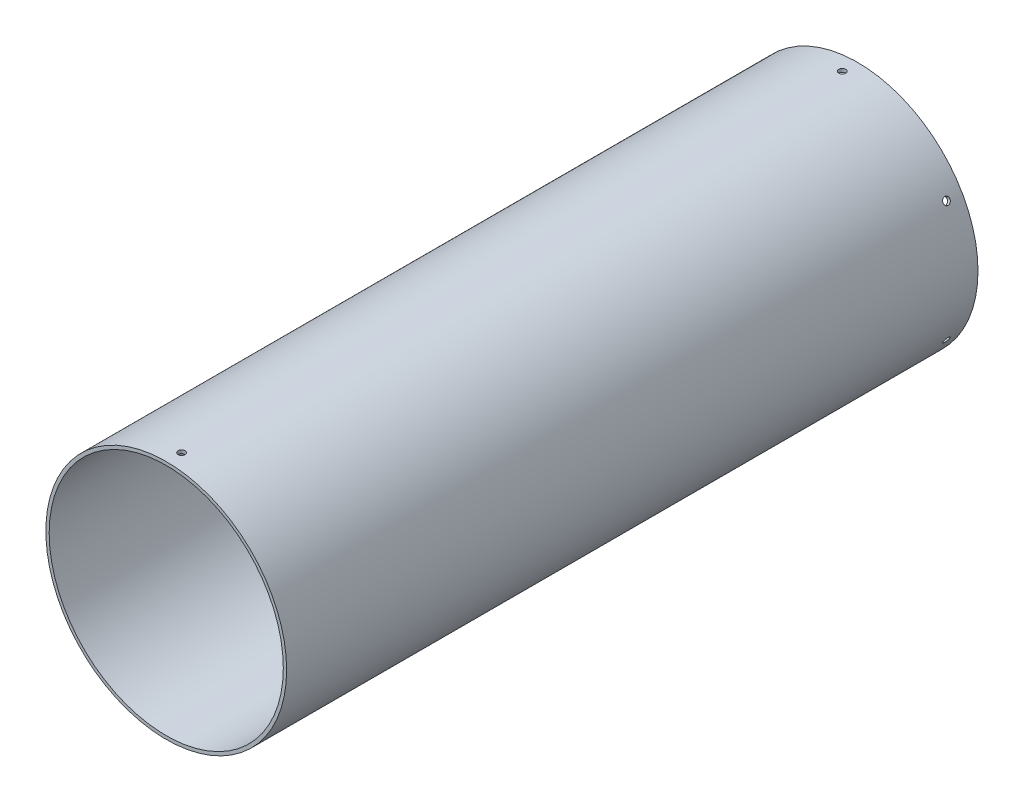
from build123d import *

# Parameters (mm, degrees)
SKETCH1_R           = 78.359
SKETCH1_R_2         = 76.2
BOSS_EXTRUDE1_DEPTH = 450
SKETCH5_W           = 2.25
SKETCH5_H           = 78.359
CIRPATTERN1_COUNT   = 6
SKETCH7_W           = 2.25
SKETCH7_H           = 78.359


with BuildPart() as part:
    # Sketch1 → Boss-Extrude1 (new body)
    with BuildSketch(Plane.XY):
        Circle(SKETCH1_R)
        Circle(SKETCH1_R_2, mode=Mode.SUBTRACT)
    extrude(amount=BOSS_EXTRUDE1_DEPTH)

    # Sketch5 → M4 Clearance Hole2 (revolve, cut)
    with BuildSketch(Plane(origin=(0, 0, 10), x_dir=(0, 0, 1), z_dir=(1, 0, 0))):
        with Locations((1.125, 39.1795)):
            Rectangle(SKETCH5_W, SKETCH5_H)
    m4_clearance_hole2 = revolve(axis=Axis((0, 6.35, 10), (0, -1, 0)), mode=Mode.SUBTRACT)

    # CirPattern1: M4 Clearance Hole2 ×6 about axis
    cirpattern1_axis = Axis((0, 0, 450), (0, 0, -1))
    for i in range(1, CIRPATTERN1_COUNT):
        add(m4_clearance_hole2.rotate(cirpattern1_axis, i * 360 / CIRPATTERN1_COUNT), mode=Mode.SUBTRACT)

    # Sketch7 → M4 Clearance Hole3 (revolve, cut)
    with BuildSketch(Plane(origin=(0, 0, 440), x_dir=(0, 0, -1), z_dir=(1, 0, 0))):
        with Locations((1.125, 39.1795)):
            Rectangle(SKETCH7_W, SKETCH7_H)
    revolve(axis=Axis((0, -6.35, 440), (0, 1, 0)), mode=Mode.SUBTRACT)


solid = part.part
